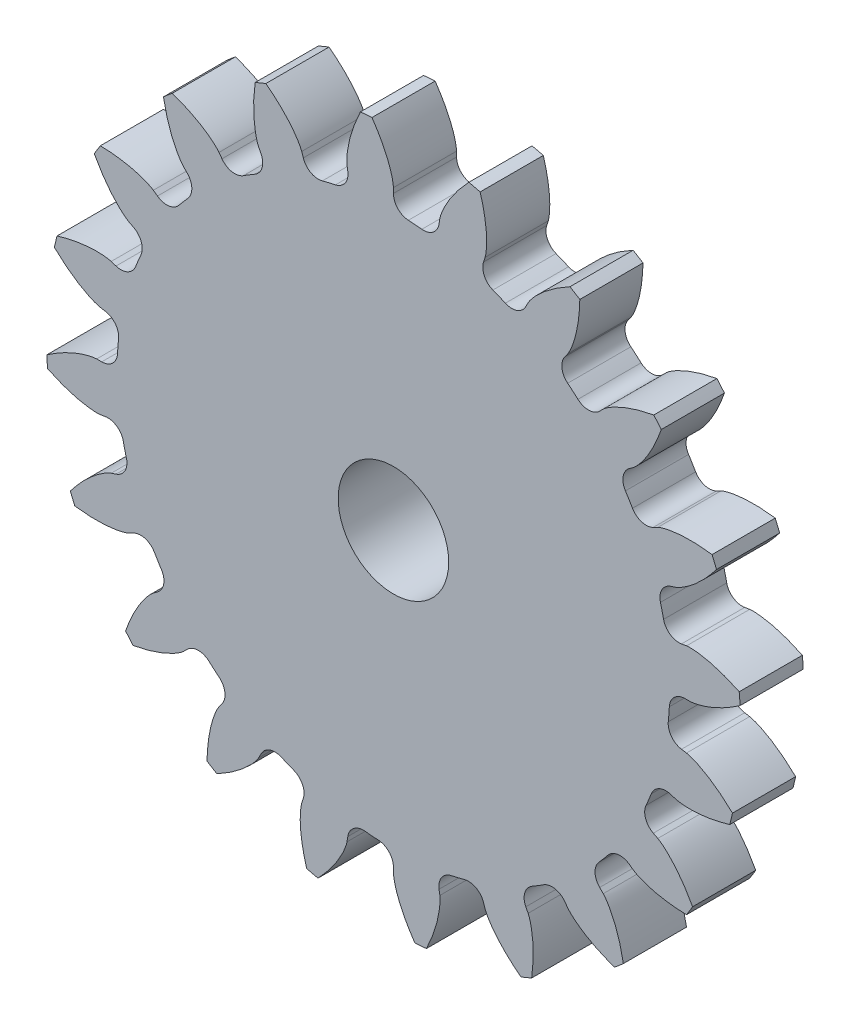
from build123d import *

# Parameters (mm, degrees)
ESQUISSE1_R                  = 1.75
BOSS_EXTRU_1_DEPTH           = 2
R_P_TITION_CIRCULAIRE1_COUNT = 8
ESQUISSE2_R                  = 1.75
BOSS_EXTRU_2_DEPTH           = 2
R_P_TITION_CIRCULAIRE2_COUNT = 20


with BuildPart() as part:
    # Esquisse1 → Boss.-Extru.1 (new body)
    with BuildSketch(Plane.XY):
        with BuildLine():
            Line((3.472651117, 1.43841919), (2.966861867, 1.228914423))
            ThreePointArc((2.966861867, 1.228914423), (2.620388837, 1.215528748), (2.348517051, 1.430722776))
            ThreePointArc((2.348517051, 1.430722776), (-2.697159521, -0.536498386), (2.717260738, -0.423076923))
            ThreePointArc((2.717260738, -0.423076923), (2.886086327, -0.120222737), (3.211308145, 0))
            Line((3.211308145, 0), (3.758770483, 0))
            add(Edge.make_bspline(
                [(3.758770483, 0), (3.761549354, 5.8806e-05), (3.769337334, 0.000405724), (3.784028362, 0.001779877), (3.807901427, 0.005038753), (3.838134992, 0.010679263), (3.876926173, 0.019667392), (3.922187036, 0.032423244), (3.971383282, 0.04869174), (4.0242313, 0.06879135), (4.076290167, 0.090944335), (4.127540745, 0.114972635), (4.177940394, 0.140634255), (4.238153324, 0.173725283), (4.309147993, 0.216177932), (4.39020503, 0.26974205), (4.479734692, 0.335077799), (4.568185757, 0.406408158), (4.652849762, 0.480448563), (4.735457366, 0.559508136), (4.813287272, 0.639008318), (4.874897846, 0.707855591), (4.914108063, 0.753231851), (4.93525174, 0.778505616), (4.938419734, 0.782311021)],
                knots=[0, 0, 0, 0, 0, 0.005376748, 0.015083688, 0.02853182, 0.046610139, 0.064854849, 0.092110525, 0.119476175, 0.146842495, 0.174208853, 0.201574955, 0.228941013, 0.256307345, 0.307035032, 0.361767351, 0.41649966, 0.471231936, 0.525964281, 0.580696615, 0.635428982, 0.690161387, 0.699805907, 0.699805907, 0.699805907, 0.699805907, 0.699805907], degree=4))
            ThreePointArc((4.938419734, 0.782311021), (4.903926402, 0.97545161), (4.861882382, 1.167090274))
            add(Edge.make_bspline(
                [(3.472651117, 1.43841919), (3.475240963, 1.439428288), (3.482568878, 1.442088108), (3.496667484, 1.44644057), (3.519970437, 1.452565587), (3.550061139, 1.45892432), (3.589339125, 1.465465114), (3.636036163, 1.471000825), (3.687713252, 1.474797284), (3.744230242, 1.476451727), (3.800803944, 1.475907103), (3.857348537, 1.473320595), (3.913732018, 1.46889946), (3.9820249, 1.461369828), (4.063861346, 1.449317178), (4.159246384, 1.430849571), (4.266963915, 1.404748727), (4.375978991, 1.372696826), (4.482532368, 1.336691923), (4.589106632, 1.295262964), (4.691435491, 1.251598588), (4.77470295, 1.211569347), (4.82829321, 1.18465225), (4.857499272, 1.169393671), (4.861882382, 1.167090274)],
                knots=[0, 0, 0, 0, 0, 0.005376748, 0.015083688, 0.02853182, 0.046610139, 0.064854849, 0.092110525, 0.119476175, 0.146842495, 0.174208853, 0.201574955, 0.228941013, 0.256307345, 0.307035032, 0.361767351, 0.41649966, 0.471231936, 0.525964281, 0.580696615, 0.635428982, 0.690161387, 0.699805907, 0.699805907, 0.699805907, 0.699805907, 0.699805907], degree=4))
        make_face()
        Circle(ESQUISSE1_R, mode=Mode.SUBTRACT)
    boss_extru_1 = extrude(amount=BOSS_EXTRU_1_DEPTH)

    # Répétition circulaire1: Boss.-Extru.1 ×8 about axis
    r_p_tition_circulaire1_axis = Axis((0, 0, 2), (0, 0, 1))
    for i in range(1, R_P_TITION_CIRCULAIRE1_COUNT):
        add(boss_extru_1.rotate(r_p_tition_circulaire1_axis, i * 360 / R_P_TITION_CIRCULAIRE1_COUNT))

    # Esquisse2 → Boss.-Extru.2 (add)
    with BuildSketch(Plane.XY.offset(2)):
        with BuildLine():
            Line((9.396926208, 0), (9.236476601, 0))
            ThreePointArc((9.236476601, 0), (8.892611448, -0.137016864), (8.737207595, -0.472972973))
            ThreePointArc((8.737207595, -0.472972973), (-8.72302667, -0.686517088), (8.555648797, 1.833950287))
            ThreePointArc((8.555648797, 1.833950287), (8.761694485, 1.526440874), (9.122760247, 1.444903276))
            Line((9.122760247, 1.444903276), (9.281234453, 1.470003124))
            add(Edge.make_bspline(
                [(9.281234453, 1.470003124), (9.284139813, 1.470422421), (9.292306458, 1.471474703), (9.307813889, 1.472975089), (9.333199859, 1.474726927), (9.365654137, 1.475934353), (9.407704396, 1.476316452), (9.457351151, 1.475249776), (9.512001032, 1.472487372), (9.571526419, 1.467765731), (9.630950665, 1.461537512), (9.690245046, 1.45391266), (9.749312466, 1.445043916), (9.820840872, 1.432798091), (9.906566646, 1.416025402), (10.006644633, 1.39338389), (10.119959202, 1.364125277), (10.235162788, 1.330491692), (10.34826389, 1.294265557), (10.462160979, 1.254081643), (10.572090299, 1.212663786), (10.68579359, 1.165997774), (10.789358628, 1.121559866), (10.875471674, 1.081498219), (10.925460279, 1.057827959), (10.950164333, 1.045897256)],
                knots=[0, 0, 0, 0, 0, 0.005376749, 0.015083688, 0.02853182, 0.04661014, 0.064854849, 0.092110526, 0.119476176, 0.146842496, 0.174208854, 0.201574956, 0.228941013, 0.256307345, 0.307035032, 0.361767352, 0.416499661, 0.471231937, 0.525964282, 0.580696616, 0.635428982, 0.690161387, 0.744893688, 0.797218479, 0.797218479, 0.797218479, 0.797218479, 0.797218479], degree=4))
            ThreePointArc((10.950164333, 1.045897256), (10.966090671, 0.863050053), (10.978964018, 0.679962574))
            add(Edge.make_bspline(
                [(9.396926208, 0), (9.399861391, 4.0364e-05), (9.408092104, 0.000278582), (9.423643325, 0.001222565), (9.448990799, 0.003463536), (9.481234394, 0.007347943), (9.522826718, 0.013548658), (9.571695374, 0.022368665), (9.62524029, 0.033646184), (9.683294193, 0.047621516), (9.74101252, 0.063069055), (9.798384098, 0.079875717), (9.855336923, 0.097875453), (9.924069027, 0.121160019), (10.006115548, 0.151136674), (10.101419496, 0.189155078), (10.208761919, 0.235779773), (10.317285706, 0.287021084), (10.42332733, 0.340494125), (10.529536007, 0.398000739), (10.631632735, 0.456105407), (10.736635977, 0.519983998), (10.831974337, 0.580075942), (10.910760166, 0.633115412), (10.956430484, 0.664314193), (10.978964018, 0.679962574)],
                knots=[0, 0, 0, 0, 0, 0.005376749, 0.015083688, 0.02853182, 0.04661014, 0.064854849, 0.092110526, 0.119476176, 0.146842496, 0.174208854, 0.201574956, 0.228941013, 0.256307345, 0.307035032, 0.361767352, 0.416499661, 0.471231937, 0.525964282, 0.580696616, 0.635428982, 0.690161387, 0.744893688, 0.797218479, 0.797218479, 0.797218479, 0.797218479, 0.797218479], degree=4))
        make_face()
        Circle(ESQUISSE2_R, mode=Mode.SUBTRACT)
    boss_extru_2 = extrude(amount=BOSS_EXTRU_2_DEPTH)

    # Répétition circulaire2: Boss.-Extru.2 ×20 about axis
    r_p_tition_circulaire2_axis = Axis((0, 0, 2), (0, 0, 1))
    for i in range(1, R_P_TITION_CIRCULAIRE2_COUNT):
        add(boss_extru_2.rotate(r_p_tition_circulaire2_axis, i * 360 / R_P_TITION_CIRCULAIRE2_COUNT))


solid = part.part
